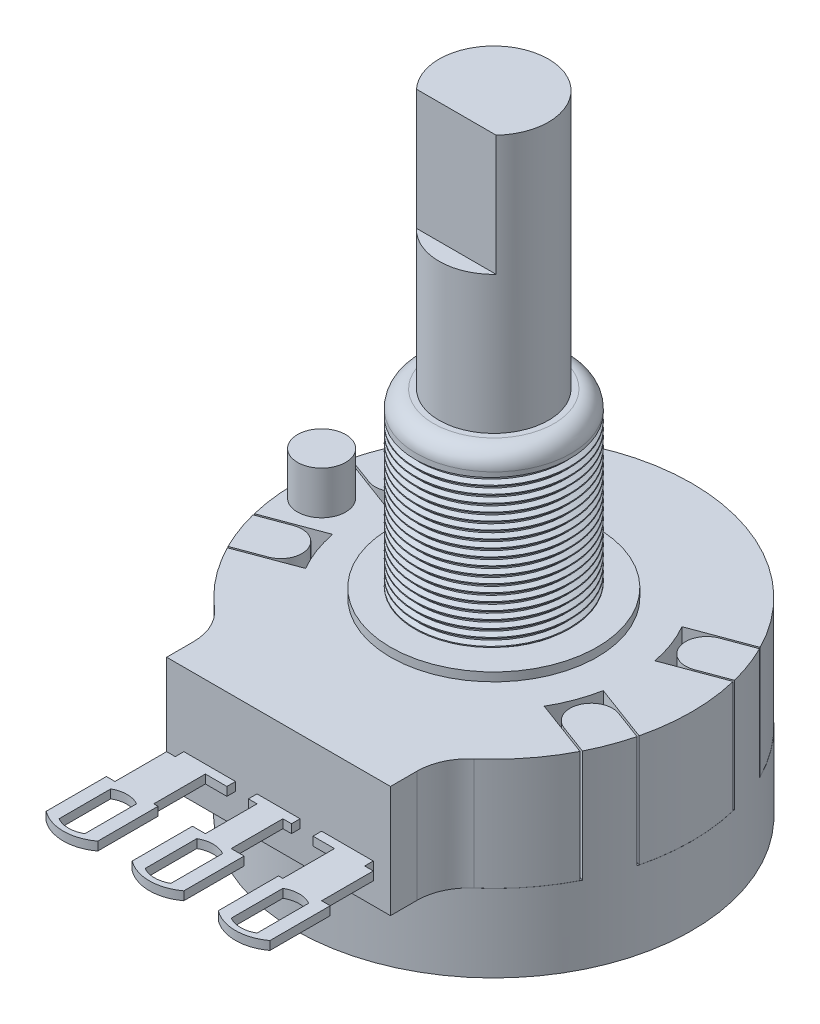
from build123d import *
from build123d.topology import SkipClean

# Parameters (mm, degrees)
SKETCH1_R               = 11.5
BOSS_EXTRUDE1_DEPTH     = 4.5
BOSS_EXTRUDE2_START     = 6.5
BOSS_EXTRUDE2_DEPTH     = 6.5
SKETCH3_R               = 6
BOSS_EXTRUDE3_DEPTH     = 0.5
SKETCH5_R               = 4.5
BOSS_EXTRUDE4_DEPTH     = 10
SKETCH6_R               = 3.175
BOSS_EXTRUDE5_DEPTH     = 15
CUT_EXTRUDE2_DEPTH      = 41.258539466801324
CUT_EXTRUDE2_DEPTH_BACK = 7
BOSS_EXTRUDE6_DEPTH     = 0.5
CUT_EXTRUDE3_DEPTH      = 0.5
SKETCH23_R              = 1.400000000000001
BOSS_EXTRUDE7_DEPTH     = 2.5
CUT_EXTRUDE4_DEPTH      = 6.5
FILLET5_R               = 0.9999999999999991
FILLET7_R               = 3
THREAD5_PITCH           = 0.44999999999999996
THREAD5_TO              = 9
CUT_EXTRUDE7_START      = -4.5
SKETCH43_R              = 11.499999999999998
CUT_EXTRUDE7_DEPTH      = 4.5
SKETCH44_R              = 11.505
BOSS_EXTRUDE15_DEPTH    = 4.5
BOSS_EXTRUDE16_START    = 6.5
BOSS_EXTRUDE16_DEPTH    = 6.5


with BuildPart() as part:
    # Sketch1 → Boss-Extrude1 (new body)
    with BuildSketch(Plane(origin=(0, 0, 0), x_dir=(1, 0, 0), z_dir=(0, 1, 0))):
        with Locations(Location((0, 0, 0), (0, 0, 270))):
            Circle(SKETCH1_R)
    extrude(amount=-BOSS_EXTRUDE1_DEPTH)

    # Sketch2 → Boss-Extrude2 (add)
    with BuildSketch(Plane(origin=(0, 0, 0), x_dir=(1, 0, 0), z_dir=(0, 1, 0)).offset(BOSS_EXTRUDE2_START)):
        with BuildLine():
            Line((-6.499999999999998, -9.486832980505143), (-6.499999999999998, -12.5))
            Line((-6.499999999999998, -12.5), (6.500000000000002, -12.5))
            Line((6.500000000000002, -12.5), (6.500000000000002, -9.48683298050514))
            ThreePointArc((6.500000000000002, -9.48683298050514), (7e-16, 11.500000000000002), (-6.499999999999998, -9.486832980505143))
        make_face()
    extrude(amount=-BOSS_EXTRUDE2_DEPTH)

    # Sketch3 → Boss-Extrude3 (add)
    with BuildSketch(Plane(origin=(0, 6.5, 0), x_dir=(1, 0, 0), z_dir=(0, 1, 0))):
        with Locations(Location((0, 0, 0), (0, 0, 270))):
            Circle(SKETCH3_R)
    extrude(amount=BOSS_EXTRUDE3_DEPTH)

    # Sketch5 → Boss-Extrude4 (add)
    with BuildSketch(Plane(origin=(0, 6.999999999999999, 0), x_dir=(1, 0, 0), z_dir=(0, 1, 0))):
        with Locations(Location((0, 0, 0), (0, 0, 270))):
            Circle(SKETCH5_R)
    extrude(amount=BOSS_EXTRUDE4_DEPTH)

    # Sketch10 → Boss-Extrude6 (add)
    with BuildSketch(Plane(origin=(0, 2.2500000000000004, 0), x_dir=(1, 0, 0), z_dir=(0, 1, 0))):
        with BuildLine():
            Line((0.7500000000000003, -16), (1.5000000000000007, -16))
            Line((1.5000000000000007, -16), (1.5000000000000009, -19.5))
            ThreePointArc((1.5000000000000009, -19.5), (1.02e-15, -20), (-1.499999999999999, -19.5))
            Line((-1.499999999999999, -19.5), (-1.4999999999999993, -16))
            Line((-1.4999999999999993, -16), (-0.7499999999999996, -16))
            Line((-0.7499999999999996, -16), (-0.75, -13.000000000000002))
            Line((-0.75, -13.000000000000002), (-1.25, -13.000000000000002))
            Line((-1.25, -13.000000000000002), (-1.25, -12.5))
            Line((-1.25, -12.5), (1.25, -12.5))
            Line((1.25, -12.5), (1.2499999999999998, -13.000000000000002))
            Line((1.2499999999999998, -13.000000000000002), (0.7500000000000002, -13.000000000000002))
            Line((0.7500000000000002, -13.000000000000002), (0.7500000000000003, -16))
        make_face()
        with BuildLine():
            Line((-6, -13.000000000000002), (-6, -16))
            Line((-6, -16), (-6.5, -16))
            Line((-6.5, -16), (-6.499999999999999, -19.5))
            ThreePointArc((-6.499999999999999, -19.5), (-4.999999999999998, -20), (-3.4999999999999996, -19.499999999999996))
            Line((-3.4999999999999996, -19.499999999999996), (-3.5, -16))
            Line((-3.5, -16), (-3.7499999999999996, -16))
            Line((-3.7499999999999996, -16), (-3.75, -13))
            Line((-3.75, -13), (-2.5000000000000004, -12.999999999999998))
            Line((-2.5000000000000004, -12.999999999999998), (-2.5000000000000004, -12.5))
            Line((-2.5000000000000004, -12.5), (-5.5, -12.499999999999998))
            Line((-5.5, -12.499999999999998), (-5.5, -13.000000000000002))
            Line((-5.5, -13.000000000000002), (-6, -13.000000000000002))
        make_face()
        with BuildLine():
            Line((3.75, -13.000000000000002), (3.7500000000000004, -16))
            Line((3.7500000000000004, -16), (3.500000000000002, -16))
            Line((3.500000000000002, -16), (3.500000000000003, -19.5))
            ThreePointArc((3.500000000000003, -19.5), (5.000000000000003, -20), (6.500000000000003, -19.5))
            Line((6.500000000000003, -19.5), (6.500000000000003, -16))
            Line((6.500000000000003, -16), (6, -16))
            Line((6, -16), (6, -13.000000000000002))
            Line((6, -13.000000000000002), (5.5, -13))
            Line((5.5, -13), (5.5, -12.500000000000004))
            Line((5.5, -12.500000000000004), (2.4999999999999996, -12.500000000000005))
            Line((2.4999999999999996, -12.500000000000005), (2.4999999999999996, -13.000000000000002))
            Line((2.4999999999999996, -13.000000000000002), (3.75, -13.000000000000002))
        make_face()
    extrude(amount=-BOSS_EXTRUDE6_DEPTH)

    # Sketch16 → Cut-Extrude3 (cut)
    with BuildSketch(Plane(origin=(0, 2.2500000000000004, 0), x_dir=(1, 0, 0), z_dir=(0, 1, 0))):
        with BuildLine():
            Line((-0.7499999999999993, -16.5), (-0.749999999999999, -19.5))
            ThreePointArc((-0.749999999999999, -19.5), (8e-16, -19.700961894323342), (0.7500000000000007, -19.5))
            Line((0.7500000000000007, -19.5), (0.7500000000000007, -16.5))
            ThreePointArc((0.7500000000000007, -16.5), (7.4e-16, -16.299038105676658), (-0.7499999999999993, -16.5))
        make_face()
        with BuildLine():
            Line((-5.75, -16.5), (-5.749999999999999, -19.5))
            ThreePointArc((-5.749999999999999, -19.5), (-5, -19.700961894323342), (-4.250000000000001, -19.5))
            Line((-4.250000000000001, -19.5), (-4.25, -16.5))
            ThreePointArc((-4.25, -16.5), (-5, -16.299038105676658), (-5.75, -16.5))
        make_face()
        with BuildLine():
            Line((4.250000000000002, -16.5), (4.250000000000003, -19.5))
            ThreePointArc((4.250000000000003, -19.5), (5.000000000000002, -19.700961894323342), (5.750000000000001, -19.5))
            Line((5.750000000000001, -19.5), (5.750000000000002, -16.5))
            ThreePointArc((5.750000000000002, -16.5), (5.000000000000002, -16.299038105676658), (4.250000000000002, -16.5))
        make_face()
    extrude(amount=-CUT_EXTRUDE3_DEPTH, mode=Mode.SUBTRACT)

    # Sketch23 → Boss-Extrude7 (add)
    with BuildSketch(Plane(origin=(0, 6.5, 0), x_dir=(1, 0, 0), z_dir=(0, 1, 0))):
        with Locations(Location((-10, -1.22e-15, 0), (0, 0, 270))):
            Circle(SKETCH23_R)
    extrude(amount=BOSS_EXTRUDE7_DEPTH)

    # Sketch24 → Cut-Extrude4 (cut)
    with BuildSketch(Plane(origin=(0, 6.5, 0), x_dir=(1, 0, 0), z_dir=(0, 1, 0))):
        with BuildLine():
            Line((-6.92820323027551, -4), (-10.240816275627783, -5.232177558993692))
            ThreePointArc((-10.240816275627783, -5.232177558993692), (-10.778500687307096, -4.0092297182526915), (-11.170729868103129, -2.732177558993692))
            Line((-11.170729868103129, -2.732177558993692), (-7.858116822750856, -1.5))
            ThreePointArc((-7.858116822750856, -1.5), (-7.498087434648412, -2.7890293692192625), (-6.92820323027551, -4))
        make_face()
        with BuildLine():
            Line((-7.858116822750856, 1.5), (-11.170729868103129, 2.7321775589936905))
            ThreePointArc((-11.170729868103129, 2.7321775589936905), (-10.778500687307096, 4.0092297182526915), (-10.240816275627783, 5.232177558993691))
            Line((-10.240816275627783, 5.232177558993691), (-6.92820323027551, 4))
            ThreePointArc((-6.92820323027551, 4), (-7.498087434648412, 2.7890293692192625), (-7.858116822750856, 1.5))
        make_face()
        with BuildLine():
            Line((6.92820323027551, 4), (10.240816275627783, 5.232177558993692))
            ThreePointArc((10.240816275627783, 5.232177558993692), (10.778500687307094, 4.0092297182526915), (11.170729868103129, 2.7321775589936914))
            Line((11.170729868103129, 2.7321775589936914), (7.858116822750856, 1.5))
            ThreePointArc((7.858116822750856, 1.5), (7.498087434648411, 2.789029369219263), (6.92820323027551, 4))
        make_face()
        with BuildLine():
            Line((7.858116822750856, -1.5), (11.170729868103129, -2.7321775589936914))
            ThreePointArc((11.170729868103129, -2.7321775589936914), (10.778500687307098, -4.009229718252685), (10.24081627562779, -5.23217755899368))
            Line((10.24081627562779, -5.23217755899368), (6.928203230275537, -3.9999999999999982))
            ThreePointArc((6.928203230275537, -3.9999999999999982), (7.498087434648435, -2.789029369219264), (7.858116822750856, -1.5))
        make_face()
    extrude(amount=-CUT_EXTRUDE4_DEPTH, mode=Mode.SUBTRACT)

    # Fillet5
    fillet5_edges = [part.edges().sort_by_distance(p)[0] for p in [
        (1.38e-15, 17, -4.5),
    ]]
    fillet(fillet5_edges, radius=FILLET5_R)

    # Fillet7
    fillet7_edges = [part.edges().sort_by_distance(p)[0] for p in [
        (6.500000000000002, 3.25, 9.48683298050514),
        (-6.5, 3.25, 9.486832980505143),
    ]]
    fillet(fillet7_edges, radius=FILLET7_R)

    # Thread5: arcs per turn and ends read off the stored shape
    # Thread5: the profile of Thread Profile6 profile screwed along a right-hand helix through 22.222222 turns, 6 arcs to a turn; built about Z, then put on its axis
    thread5_z = Axis((0, 0, 0), (0, 0, 1))
    thread5_corners = [(4.5003, -1e-09, -0.000173205), (4.5003, -1e-09, 0.393923204), (4.256430356, -1e-09, 0.253124999), (4.256430356, -1e-09, 0.140624999)]
    with BuildLine(mode=Mode.PRIVATE) as thread5_profile:
        Line(thread5_corners[0], thread5_corners[1])
        Line(thread5_corners[1], thread5_corners[2])
        Line(thread5_corners[2], thread5_corners[3])
        Line(thread5_corners[3], thread5_corners[0])
    thread5_cap = Face(thread5_profile.wire())
    thread5_turn_angles = [0, 30, 60, 90, 120, 150, 180, 210, 240, 270, 300, 330, 360]
    thread5_turn_weights = [1, 0.8660254037844387, 1, 0.8660254037844387, 1, 0.8660254037844387, 1, 0.8660254037844387, 1, 0.8660254037844387, 1, 0.8660254037844387, 1]
    thread5_turn_rails = [Edge.make_bspline([Vector(p[0], p[1], 0).rotate(thread5_z, thread5_turn_angles[k]) / thread5_turn_weights[k] + Vector(0, 0, p[2] + THREAD5_PITCH * thread5_turn_angles[k] / 360) for k in range(13)], [0, 0, 0, 1, 1, 2, 2, 3, 3, 4, 4, 5, 5, 6, 6, 6], 2, thread5_turn_weights) for p in thread5_corners]
    thread5_turn_sides = [Face.make_surface_from_curves(thread5_turn_rails[p[0]], thread5_turn_rails[p[1]]) for p in [(0, 1), (1, 2), (2, 3), (3, 0)]]
    thread5_last_angles = [7920, 7950, 7980, 7990, 8000]
    thread5_last_weights = [1, 0.8660254037844387, 1, 0.9848077530122108, 1]
    thread5_last_rails = [Edge.make_bspline([Vector(p[0], p[1], 0).rotate(thread5_z, thread5_last_angles[k]) / thread5_last_weights[k] + Vector(0, 0, p[2] + THREAD5_PITCH * thread5_last_angles[k] / 360) for k in range(5)], [0, 0, 0, 1, 1, 2, 2, 2], 2, thread5_last_weights) for p in thread5_corners]
    thread5_last_sides = [Face.make_surface_from_curves(thread5_last_rails[p[0]], thread5_last_rails[p[1]]) for p in [(0, 1), (1, 2), (2, 3), (3, 0)]]
    thread5 = Plane(origin=(0, 16, 0), x_dir=(-0.999390827, 0, -0.034899497), z_dir=(0, -1, 0)) * split(Solid(Shell([*[p.moved(Location((0, 0, THREAD5_PITCH * i))) for i in range(22) for p in thread5_turn_sides], *thread5_last_sides, thread5_cap, thread5_cap.rotate(thread5_z, 8000).moved(Location((0, 0, THREAD5_PITCH * 8000 / 360)))])), bisect_by=Plane.XY.offset(THREAD5_TO), keep=Keep.BOTTOM, mode=Mode.PRIVATE)
    add(thread5, mode=Mode.SUBTRACT)

    # Sketch43 → Cut-Extrude7 (cut)
    with BuildSketch(Plane.XZ.offset(4.5).offset(CUT_EXTRUDE7_START)):
        Circle(SKETCH43_R)
    extrude(amount=CUT_EXTRUDE7_DEPTH, mode=Mode.SUBTRACT)

    # Sketch44 → Boss-Extrude15 (add)
    with BuildSketch(Plane(origin=(0, 0, 0), x_dir=(1, 0, 0), z_dir=(0, 1, 0))):
        with Locations(Location((0, 0, 0), (0, 0, 270))):
            Circle(SKETCH44_R)
    extrude(amount=-BOSS_EXTRUDE15_DEPTH)

    # Sketch45 → Boss-Extrude16 (add)
    with SkipClean():  # the faces are left unmerged after this step: merging them gives an invalid solid
        with BuildSketch(Plane(origin=(0, 0, 0), x_dir=(1, 0, 0), z_dir=(0, 1, 0)).offset(BOSS_EXTRUDE16_START)):
            with BuildLine():
                Line((9.44815832736803, 2.1981343576317656), (11.1511084499258, 2.831572944141376))
                ThreePointArc((11.1511084499258, 2.831572944141376), (10.78318699195375, 4.010972861608454), (10.290920591680953, 5.14412075827512))
                Line((10.290920591680953, 5.14412075827512), (8.587970469123182, 4.510682171765509))
                ThreePointArc((8.587970469123182, 4.510682171765509), (7.861790491178707, 2.9243143355762005), (9.44815832736803, 2.1981343576317656))
            make_face()
            with BuildLine():
                Line((8.587970469123194, -4.510682171765506), (10.290920591680955, -5.144120758275111))
                ThreePointArc((10.290920591680955, -5.144120758275111), (10.78318699195376, -4.010972861608416), (11.151108449925815, -2.8315729441413104))
                Line((11.151108449925815, -2.8315729441413104), (9.448158327368061, -2.1981343576317065))
                ThreePointArc((9.448158327368061, -2.1981343576317065), (7.861790491178717, -2.9243143355761805), (8.587970469123194, -4.510682171765506))
            make_face()
            with BuildLine():
                Line((-9.448158327368033, -2.1981343576317385), (-11.151108449925804, -2.8315729441413513))
                ThreePointArc((-11.151108449925804, -2.8315729441413513), (-10.783186991953746, -4.010972861608452), (-10.29092059168094, -5.144120758275141))
                Line((-10.29092059168094, -5.144120758275141), (-8.587970469123166, -4.510682171765529))
                ThreePointArc((-8.587970469123166, -4.510682171765529), (-7.861790491178708, -2.924314335576203), (-9.448158327368033, -2.1981343576317385))
            make_face()
            with BuildLine():
                Line((-9.448158327368038, 2.198134357631741), (-11.151108449925806, 2.8315729441413495))
                ThreePointArc((-11.151108449925806, 2.8315729441413495), (-10.783186991953746, 4.010972861608452), (-10.29092059168094, 5.14412075827514))
                Line((-10.29092059168094, 5.14412075827514), (-8.587970469123174, 4.510682171765531))
                ThreePointArc((-8.587970469123174, 4.510682171765531), (-7.861790491178708, 2.924314335576204), (-9.448158327368038, 2.198134357631741))
            make_face()
        extrude(amount=-BOSS_EXTRUDE16_DEPTH)


with BuildPart() as body_2:
    # Sketch6 → Boss-Extrude5 (new body)
    with BuildSketch(Plane(origin=(0, 17, 0), x_dir=(1, 0, 0), z_dir=(0, 1, 0))):
        with Locations(Location((0, 0, 0), (0, 0, 270))):
            Circle(SKETCH6_R)
    extrude(amount=BOSS_EXTRUDE5_DEPTH)

    # Sketch7 → Cut-Extrude2 (cut, two sides: drawn at the far end of the back side and taken through both)
    with BuildSketch(Plane(origin=(0, 32, 0), x_dir=(1, 0, 0), z_dir=(0, 1, 0)).offset(-CUT_EXTRUDE2_DEPTH_BACK)):
        Polygon((-51.18740851676345, -2.175), (-2.3130067012440754, -2.175), (2.3130067012440754, -2.175), (51.18740851676345, -2.175), (51.18740851676345, -99.92380363103874), (-51.18740851676345, -99.92380363103874), align=None)
    extrude(amount=CUT_EXTRUDE2_DEPTH + CUT_EXTRUDE2_DEPTH_BACK, mode=Mode.SUBTRACT)


solid = Compound([part.part, body_2.part])
